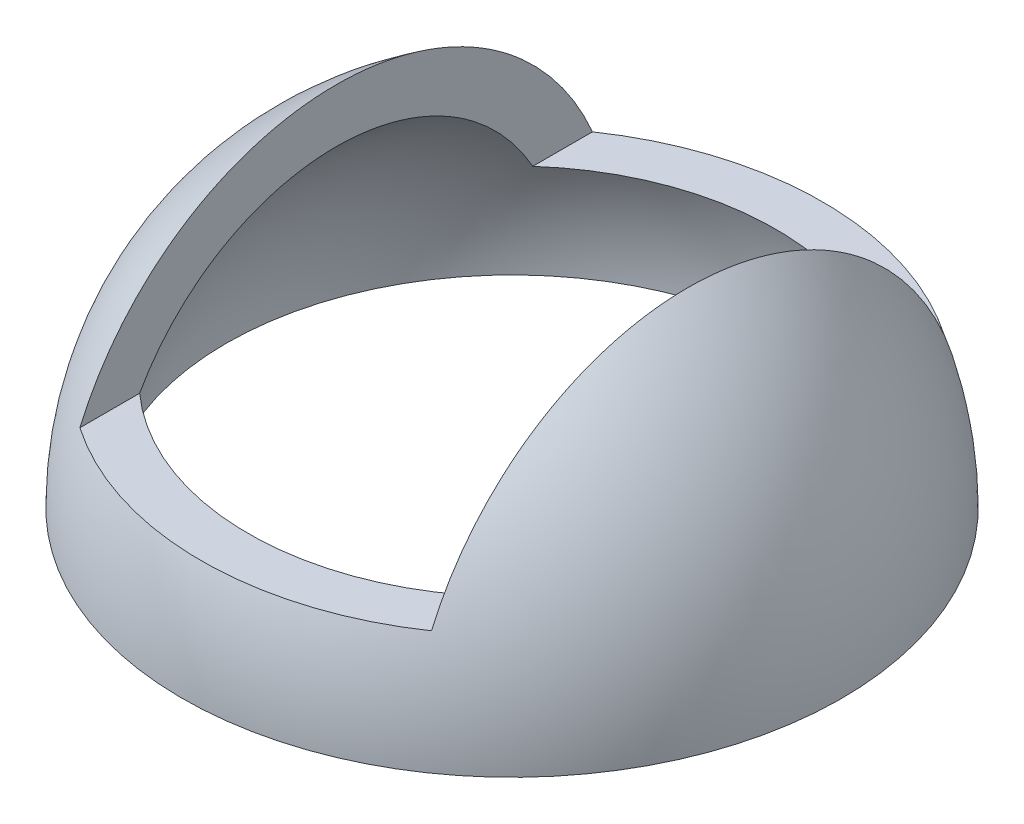
from build123d import *

# Parameters (mm, degrees)
SKETCH2_W          = 20.32
SKETCH2_H          = 16.418842622
CUT_EXTRUDE1_DEPTH = 63.5


with BuildPart() as part:
    # Sketch1 → Revolve1 (revolve)
    with BuildSketch(Plane.XY):
        with BuildLine():
            Line((19.05, 0), (16.51, 0))
            ThreePointArc((16.51, 0), (11.674332957, 11.674332957), (0, 16.51))
            Line((0, 16.51), (0, 19.05))
            ThreePointArc((0, 19.05), (13.470384182, 13.470384182), (19.05, 0))
        make_face()
    revolve(axis=Axis((0, 19.05, 0), (0, -1, 0)))

    # Sketch2 → Cut-Extrude1 (cut, symmetric)
    with BuildSketch(Plane.XY):
        with Locations((0, 14.559421311)):
            Rectangle(SKETCH2_W, SKETCH2_H)
    extrude(amount=CUT_EXTRUDE1_DEPTH, both=True, mode=Mode.SUBTRACT)


solid = part.part
